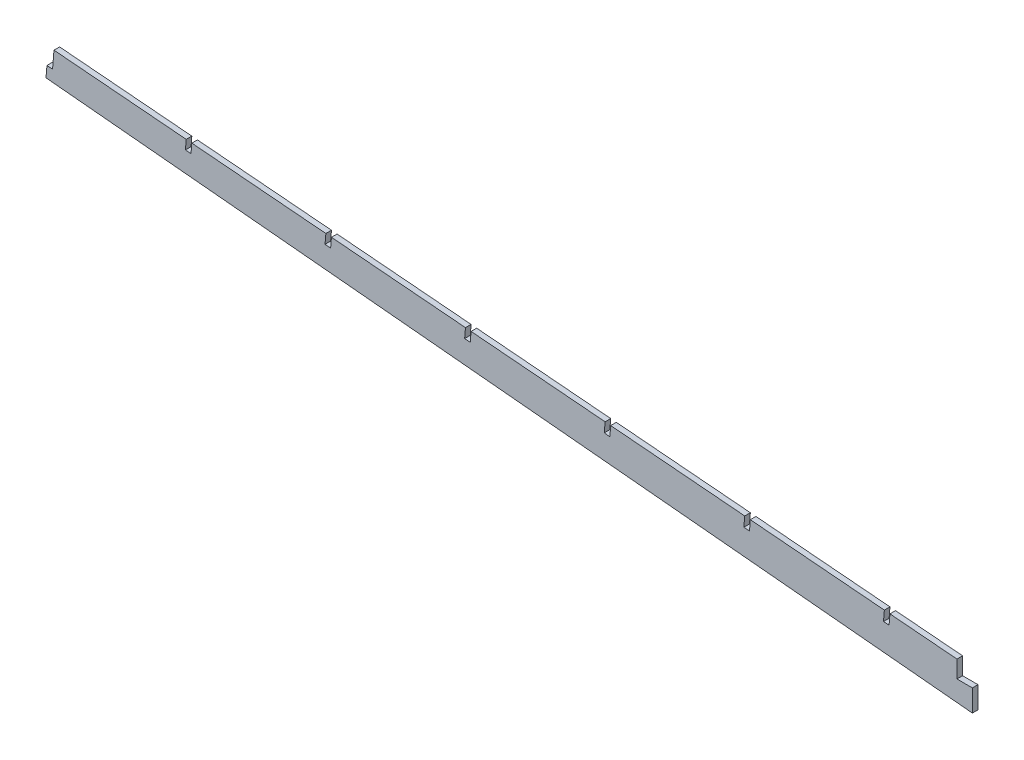
from build123d import *

# Parameters (mm, degrees)
BOSS_EXTRUDE1_DEPTH = 3.175
CUT_EXTRUDE1_DEPTH  = 955.350997373
CUT_EXTRUDE2_DEPTH  = 7.62


with BuildPart() as part:
    # Sketch1 → Boss-Extrude1 (new body)
    with BuildSketch(Plane.XY):
        Polygon((-950.530495659, 69.619322302), (-951.061849964, 63.291592645), (-11.536706102, -24.902638492), (-8.372841274, -25.168315645), (0, -25.545856054), (152.4, -25.545856054), (152.4, -7.765856054), (139.7, -7.765856054), (139.7, -12.845856054), (136.525, -12.845856054), (136.525, -7.765856054), (95.25, -7.765856054), (95.25, -12.845856054), (92.075, -12.845856054), (92.075, -7.765856054), (79.375, -7.765856054), (79.375, -12.845856054), (76.2, -12.845856054), (76.2, -7.765856054), (69.85, -7.765856054), (25.4, -0.145856054), (19.05, -0.145856054), (19.05, -5.225856054), (15.875, -5.225856054), (15.875, -0.145856054), (3.175, -0.145856054), (3.175, -6.495856054), (0, -6.495856054), (0, -0.145856054), (-2.81225704, -0.145856054), (-6.247424053, 0.14260298), (-6.778778359, -6.185126677), (-9.942643187, -5.919449524), (-9.411288881, 0.408280132), (-946.54805097, 79.101852726), (-947.366630831, 69.353645149), align=None)
    extrude(amount=BOSS_EXTRUDE1_DEPTH)

    # Sketch2 → Cut-Extrude1 (cut, through all)
    with BuildSketch(Plane.XY.offset(3.175)):
        Polygon((-79.415081651, -0.013332249), (-78.889760507, 6.242550403), (-82.053625335, 6.508227555), (-82.578671745, 0.255616625), align=None)
        Polygon((-158.378290396, 6.699631648), (-157.859826617, 12.873852131), (-161.023691445, 13.139529284), (-161.54188049, 6.968580522), align=None)
        Polygon((-237.341499142, 13.412595546), (-236.829892727, 19.50515386), (-239.993757555, 19.770831012), (-240.505089236, 13.68154442), align=None)
        Polygon((-316.304707888, 20.125559443), (-315.799958836, 26.136455588), (-318.963823664, 26.402132741), (-319.468297982, 20.394508317), align=None)
        Polygon((-395.267916634, 26.83852334), (-394.770024946, 32.767757316), (-397.933889774, 33.033434469), (-398.431506728, 27.107472214), align=None)
        Polygon((-474.23112538, 33.551487238), (-473.740091056, 39.399059045), (-476.903955884, 39.664736197), (-477.394715474, 33.820436112), align=None)
        Polygon((-553.194334126, 40.264451135), (-552.710157166, 46.030360773), (-555.874021994, 46.296037926), (-556.35792422, 40.533400009), align=None)
        Polygon((-632.157542872, 46.977415032), (-631.680223276, 52.661662502), (-634.844088104, 52.927339654), (-635.321132966, 47.246363906), align=None)
        Polygon((-711.120751618, 53.69037893), (-710.650289385, 59.29296423), (-713.814154213, 59.558641383), (-714.284341712, 53.959327804), align=None)
        Polygon((-790.083960364, 60.403342827), (-789.620355495, 65.924265958), (-792.784220323, 66.189943111), (-793.247550458, 60.672291701), align=None)
        Polygon((-869.047169109, 67.116306724), (-868.590421605, 72.555567687), (-871.754286433, 72.821244839), (-872.210759203, 67.385255598), align=None)
    extrude(amount=-CUT_EXTRUDE1_DEPTH, mode=Mode.SUBTRACT)

    # Sketch3 → Cut-Extrude2 (cut)
    with BuildSketch(Plane.XY.offset(3.175)):
        Polygon((-435.836990415, 36.216246757), (-435.836990415, 26.451619727), (-427.115588921, 26.451619727), (-427.115588921, 14.108196169), (150.838987184, -84.054223576), (191.196568658, 26.451619727), align=None)
    extrude(amount=-CUT_EXTRUDE2_DEPTH, mode=Mode.SUBTRACT)


solid = part.part
